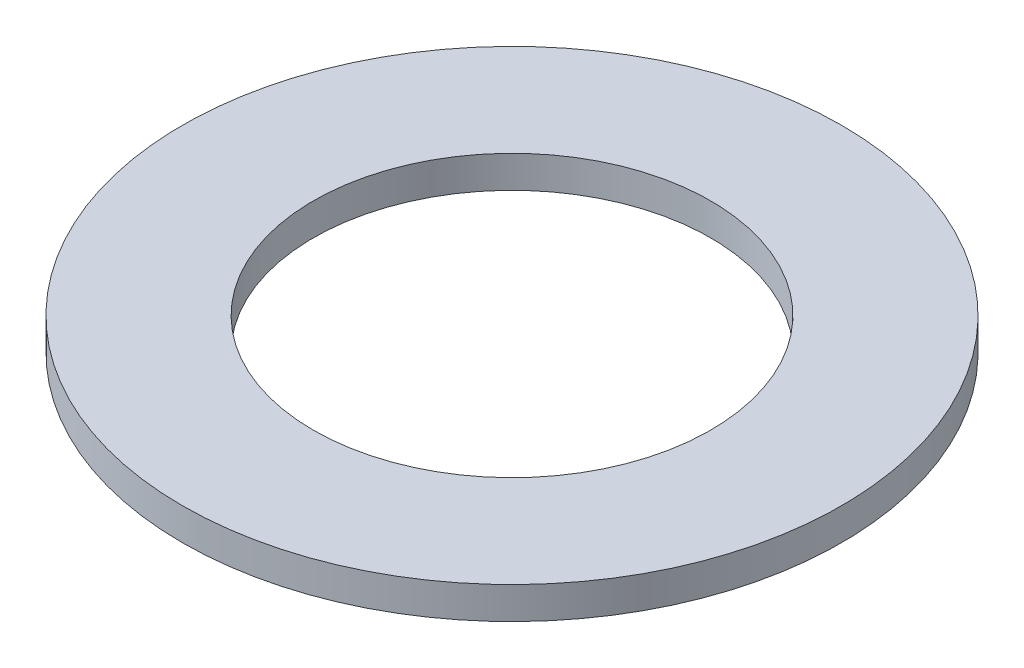
from build123d import *

# Parameters (mm, degrees)
SKETCH1_R           = 82.2
SKETCH1_R_2         = 49.55
BOSS_EXTRUDE1_DEPTH = 8


with BuildPart() as part:
    # Sketch1 → Boss-Extrude1 (new body)
    with BuildSketch(Plane(origin=(0, 0, 0), x_dir=(1, 0, 0), z_dir=(0, 1, 0))):
        Circle(SKETCH1_R)
        Circle(SKETCH1_R_2, mode=Mode.SUBTRACT)
    extrude(amount=BOSS_EXTRUDE1_DEPTH)


solid = part.part
